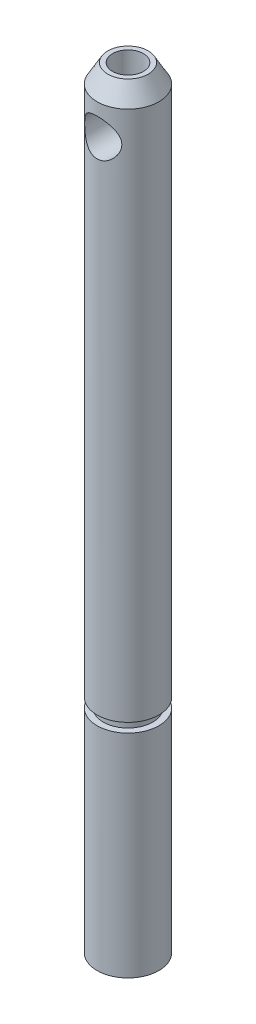
from build123d import *

# Parameters (mm, degrees)
SKETCH3_R                 = 2.5
BOSS_EXTRUDE1_DEPTH       = 62.34264779
CHAMFER1_SIZE             = 1.5
CHAMFER1_SIZE2            = 0.866025404
M3X0_5_TAPPED_HOLE1_D     = 2.5
M3X0_5_TAPPED_HOLE1_DEPTH = 4
M3X0_5_TAPPED_HOLE1_TIP   = 0.751075774
CUT_EXTRUDE1_DEPTH        = 63.442819711
CUT_EXTRUDE1_DEPTH_BACK   = 63.442819711
SKETCH7_R                 = 1.5
CUT_EXTRUDE2_DEPTH        = 63.442819819
CUT_EXTRUDE2_DEPTH_BACK   = 63.442819819
SKETCH8_W                 = 1
SKETCH8_H                 = 6
SKETCH9_R                 = 3
SKETCH9_R_2               = 2
CUT_EXTRUDE3_DEPTH        = 0.75


with BuildPart() as part:
    # Sketch3 → Boss-Extrude1 (new body)
    with BuildSketch(Plane(origin=(0, 0, 0), x_dir=(1, 0, 0), z_dir=(0, 1, 0))):
        Circle(SKETCH3_R)
    extrude(amount=BOSS_EXTRUDE1_DEPTH)

    # Chamfer1
    chamfer1_edges = [part.edges().sort_by_distance(p)[0] for p in [
        (-2.5, 62.34264779, 0),
    ]]
    chamfer1_side = [part.faces().sort_by_distance(p)[0] for p in [
        (-2.5, 31.171323895, 0),
    ]]
    chamfer(chamfer1_edges, length=CHAMFER1_SIZE, length2=CHAMFER1_SIZE2, reference=chamfer1_side[0])

    # M3x0.5 Tapped Hole1
    with Locations(Plane(origin=(0, 62.34264779, 0), x_dir=(1, 0, 0), z_dir=(0, 1, 0))):
        with Locations((0, 0)):
            Hole(M3X0_5_TAPPED_HOLE1_D / 2, depth=M3X0_5_TAPPED_HOLE1_DEPTH)
            with Locations((0, 0, -(M3X0_5_TAPPED_HOLE1_DEPTH + M3X0_5_TAPPED_HOLE1_TIP / 2))):  # 118° drill point
                Cone(0, M3X0_5_TAPPED_HOLE1_D / 2, M3X0_5_TAPPED_HOLE1_TIP, mode=Mode.SUBTRACT)

    # Sketch7 → Cut-Extrude1 (cut, two sides: drawn at the far end of the back side and taken through both)
    with BuildSketch(Plane.XY.offset(-CUT_EXTRUDE1_DEPTH_BACK)):
        with Locations((0, 58.34264779)):
            Circle(SKETCH7_R)
    extrude(amount=CUT_EXTRUDE1_DEPTH + CUT_EXTRUDE1_DEPTH_BACK, mode=Mode.SUBTRACT)

    # Sketch8 → Cut-Extrude2 (cut, two sides: drawn at the far end of the back side and taken through both)
    with BuildSketch(Plane.XY.offset(-CUT_EXTRUDE2_DEPTH_BACK)):
        with Locations((-2, 3)):
            Rectangle(SKETCH8_W, SKETCH8_H)
    extrude(amount=CUT_EXTRUDE2_DEPTH + CUT_EXTRUDE2_DEPTH_BACK, mode=Mode.SUBTRACT)

    # Sketch9 → Cut-Extrude3 (cut)
    with BuildSketch(Plane(origin=(0, 17.15, 0), x_dir=(1, 0, 0), z_dir=(0, 1, 0))):
        Circle(SKETCH9_R)
        Circle(SKETCH9_R_2, mode=Mode.SUBTRACT)
    extrude(amount=CUT_EXTRUDE3_DEPTH, mode=Mode.SUBTRACT)


solid = part.part
